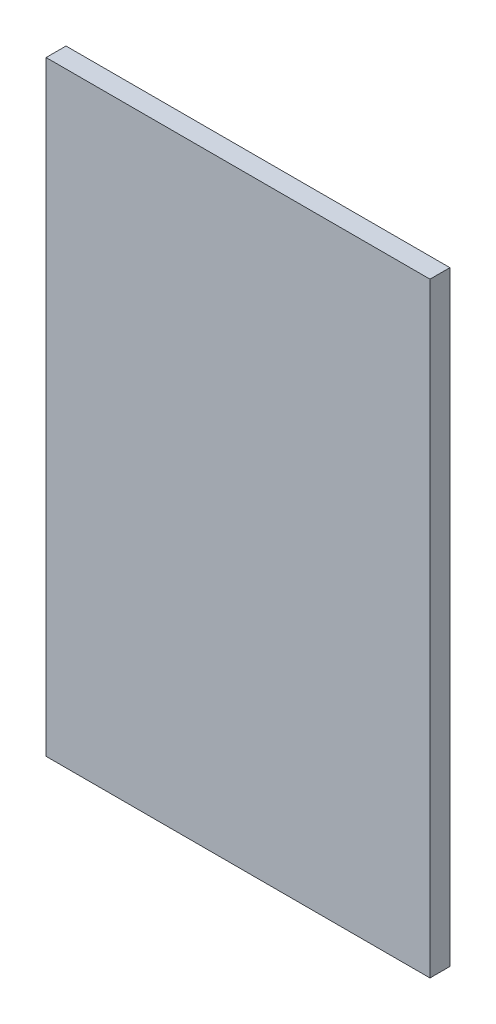
from build123d import *

# Parameters (mm, degrees)
SKETCH1_W           = 346.71
SKETCH1_H           = 546.608
BOSS_EXTRUDE1_DEPTH = 18


with BuildPart() as part:
    # Sketch1 → Boss-Extrude1 (new body)
    with BuildSketch(Plane.XY):
        with Locations((173.355, 273.304)):
            Rectangle(SKETCH1_W, SKETCH1_H)
    extrude(amount=BOSS_EXTRUDE1_DEPTH)


solid = part.part
